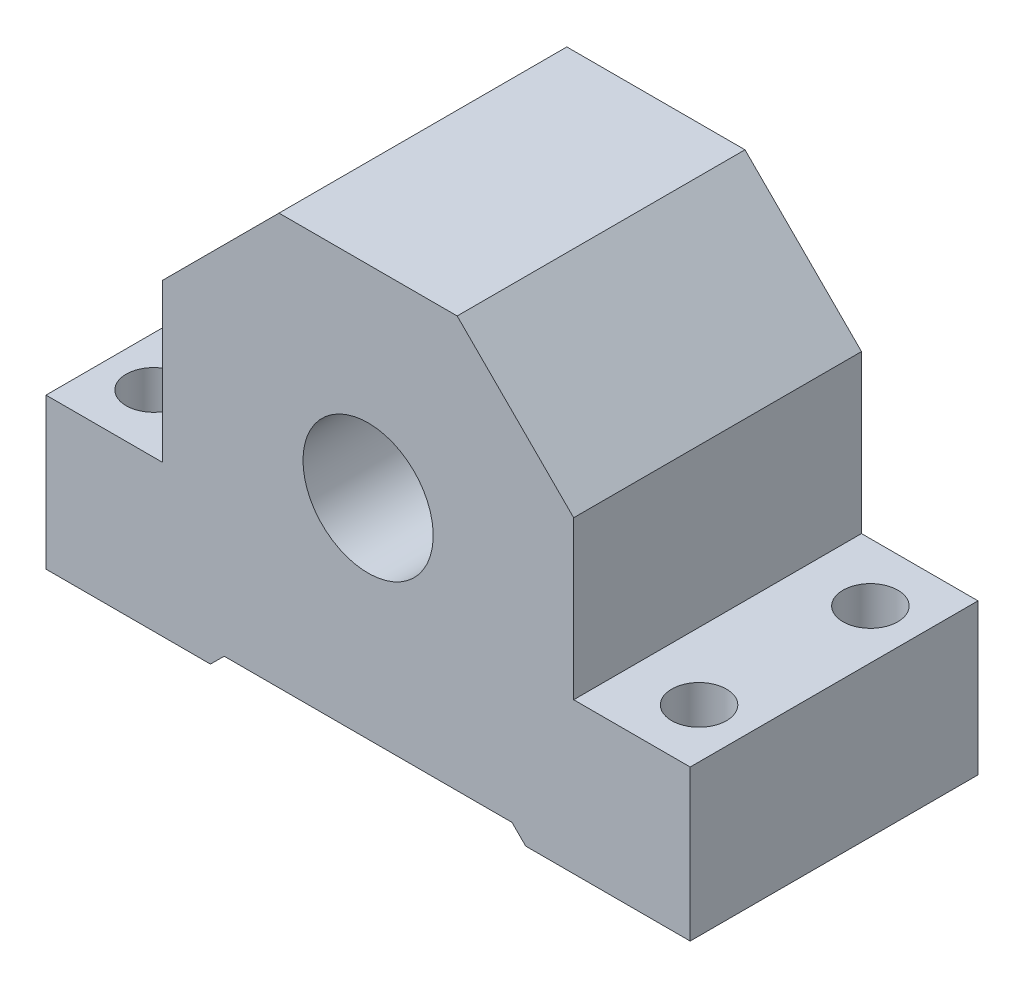
from build123d import *

# Parameters (mm, degrees)
DODANIE_WYCI_GNI_CIE1_DEPTH = 42
SZKIC2_R                    = 9.5
WYTNIJ_WYCI_GNI_CIE1_DEPTH  = 42
SZKIC3_R                    = 4
WYTNIJ_WYCI_GNI_CIE2_DEPTH  = 22


with BuildPart() as part:
    # Szkic1 → Dodanie-wyciągnięcie1 (new body)
    with BuildSketch(Plane.XY):
        Polygon((-47, 11), (-30, 11), (-30, 34), (-13, 51), (13, 51), (30, 34), (30, 11), (47, 11), (47, -11), (23, -11), (21, -9), (-21, -9), (-23, -11), (-47, -11), align=None)
    extrude(amount=DODANIE_WYCI_GNI_CIE1_DEPTH)

    # Szkic2 → Wytnij-wyciągnięcie1 (cut)
    with BuildSketch(Plane(origin=(0, 0, 0), x_dir=(-1, 0, 0), z_dir=(0, 0, -1))):
        with Locations((0, 21.5)):
            Circle(SZKIC2_R)
    extrude(amount=-WYTNIJ_WYCI_GNI_CIE1_DEPTH, mode=Mode.SUBTRACT)

    # Szkic3 → Wytnij-wyciągnięcie2 (cut)
    with BuildSketch(Plane(origin=(0, 11, 0), x_dir=(1, 0, 0), z_dir=(0, 1, 0))):
        with Locations((-39.8, -8.5)):
            Circle(SZKIC3_R)
        with Locations((-39.8, -33.5)):
            Circle(SZKIC3_R)
        with Locations((39.8, -33.5)):
            Circle(SZKIC3_R)
        with Locations((39.8, -8.5)):
            Circle(SZKIC3_R)
    extrude(amount=-WYTNIJ_WYCI_GNI_CIE2_DEPTH, mode=Mode.SUBTRACT)


solid = part.part
